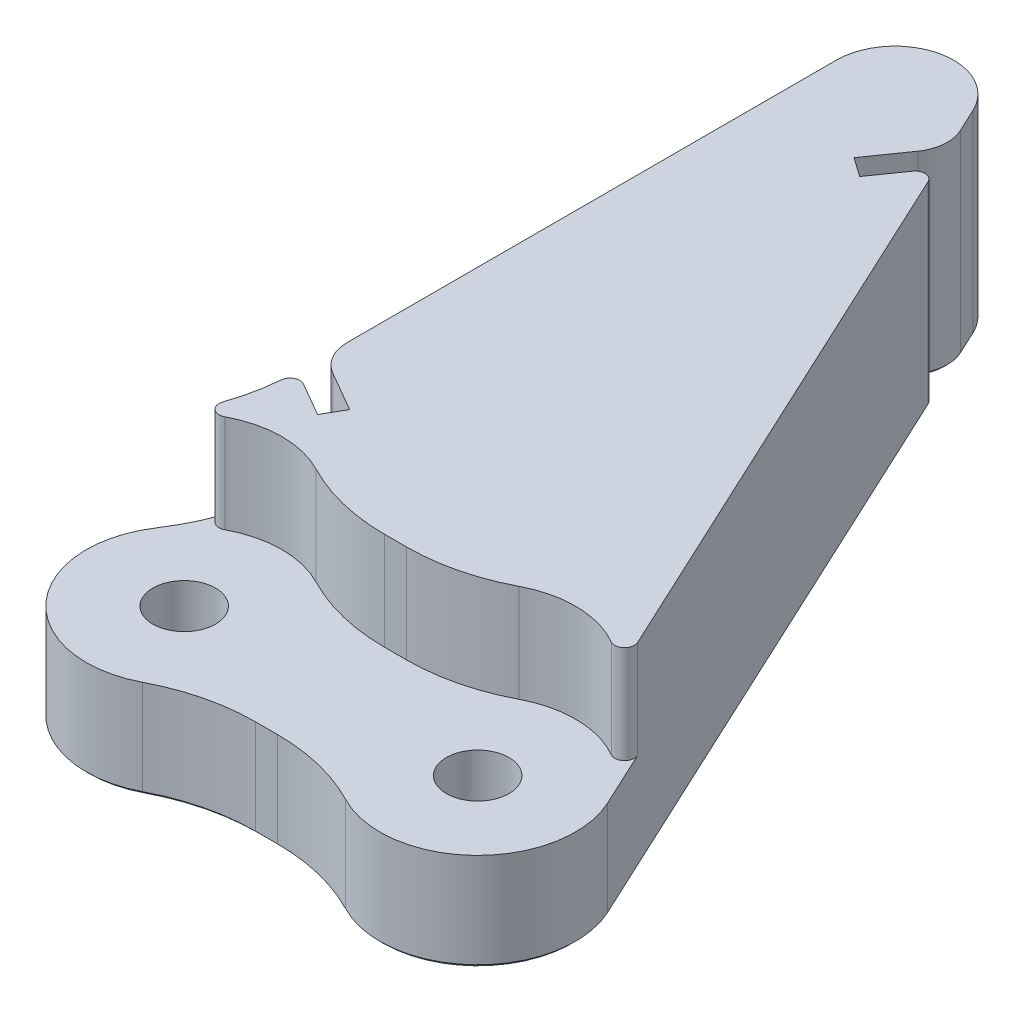
from build123d import *

# Parameters (mm, degrees)
MAIN_BODY_DEPTH                           = 10
SKETCH1_3_R                               = 1.6
CONNECTOR_BODY_DEPTH                      = 5
DULLING_FILLET_START                      = 5
DULLING_FILLET_DEPTH                      = 6
CUT_EXTRUDE1_DEPTH                        = 45.806187552
FILLET1_R                                 = 2
FILLET2_R                                 = 0.5
ELEPHANTSFOOT_COMPENSATION_LEFT_CONF_SIZE = 0.16


with BuildPart() as part:
    # complete_sketch → main_body (new body)
    with BuildSketch(Plane(origin=(0, 0, 0), x_dir=(1, 0, 0), z_dir=(0, 1, 0))):
        with BuildLine():
            ThreePointArc((-2.5, 8.291561976), (-2.925728922, 5.40481063), (-4.166666667, 2.763853992))
            ThreePointArc((-4.166666667, 2.763853992), (-1.24767584, 4.841828683), (2.312045751, 4.433333333))
            ThreePointArc((2.312045751, 4.433333333), (4.555661111, 3.587465144), (6.936137254, 3.3))
            Line((6.936137254, 3.3), (8.063862746, 3.3))
            ThreePointArc((8.063862746, 3.3), (10.444338889, 3.587465144), (12.687954249, 4.433333333))
            ThreePointArc((12.687954249, 4.433333333), (16.605433979, 4.735248857), (19.531538935, 2.113091309))
            Line((19.531538935, 2.113091309), (3.218923361, 37.095608299))
            ThreePointArc((3.218923361, 37.095608299), (-0.149318842, 38.756641535), (-2.5, 35.827753514))
            Line((-2.5, 35.827753514), (-2.5, 8.291561976))
        make_face()
    extrude(amount=MAIN_BODY_DEPTH)

    # Sketch1<3> → connector_body (add)
    with BuildSketch(Plane(origin=(0, 0, 0), x_dir=(1, 0, 0), z_dir=(0, 1, 0))):
        with BuildLine():
            ThreePointArc((2.312045751, -4.433333333), (4.555661111, -3.587465144), (6.936137254, -3.3))
            Line((6.936137254, -3.3), (8.063862746, -3.3))
            ThreePointArc((8.063862746, -3.3), (10.444338889, -3.587465144), (12.687954249, -4.433333333))
            ThreePointArc((12.687954249, -4.433333333), (18.456219958, -3.613107195), (19.531538935, 2.113091309))
            ThreePointArc((19.531538935, 2.113091309), (16.605433979, 4.735248857), (12.687954249, 4.433333333))
            ThreePointArc((12.687954249, 4.433333333), (10.444338889, 3.587465144), (8.063862746, 3.3))
            Line((8.063862746, 3.3), (6.936137254, 3.3))
            ThreePointArc((6.936137254, 3.3), (4.555661111, 3.587465144), (2.312045751, 4.433333333))
            ThreePointArc((2.312045751, 4.433333333), (-1.24767584, 4.841828683), (-4.166666667, 2.763853992))
            ThreePointArc((-4.166666667, 2.763853992), (-3.716151374, -3.345178466), (2.312045751, -4.433333333))
        make_face()
        with Locations(Location((0, 0, 0), (0, 0, 270))):
            Circle(SKETCH1_3_R, mode=Mode.SUBTRACT)
        with Locations(Location((15, 0, 0), (0, 0, 270))):
            Circle(SKETCH1_3_R, mode=Mode.SUBTRACT)
    extrude(amount=CONNECTOR_BODY_DEPTH)

    # dulling_fillet: read off the stored shape, not the designer's step
    # dulling_fillet outline → dulling_fillet (cut)
    with BuildSketch(Plane(origin=(0, 0, 0), x_dir=(1, 0, 0), z_dir=(0, 1, 0)).offset(DULLING_FILLET_START)):
        with BuildLine():
            Line((19.531538935, 2.113091309), (18.195102647, 4.979088177))
            ThreePointArc((18.195102647, 4.979088177), (18.080055144, 4.399425861), (17.492680685, 4.334344587))
            ThreePointArc((17.492680685, 4.334344587), (18.683531845, 3.381063908), (19.531538935, 2.113091309))
        make_face()
        with BuildLine():
            ThreePointArc((-4.166666667, 2.763853992), (-3.358016887, 3.704554303), (-2.342670216, 4.417227214))
            ThreePointArc((-2.342670216, 4.417227214), (-2.902133749, 4.479151002), (-3.049464036, 5.022407651))
            ThreePointArc((-3.049464036, 5.022407651), (-3.536643042, 3.85780149), (-4.166666667, 2.763853992))
        make_face()
    extrude(amount=DULLING_FILLET_DEPTH, mode=Mode.SUBTRACT)

    # Sketch2 → Cut-Extrude1 (cut, through all)
    with BuildSketch(Plane(origin=(0, 10, 0), x_dir=(1, 0, 0), z_dir=(0, 1, 0))):
        Polygon((-2.5, 8.291561976), (-0.068911087, 6.887972137), (0.531088913, 7.927202622), (-2.5, 9.677202622), align=None)
        Polygon((4.275469015, 34.829838831), (2.267951488, 31.962806676), (3.250933941, 31.274514953), (4.861066057, 33.574021924), align=None)
    extrude(amount=-CUT_EXTRUDE1_DEPTH, mode=Mode.SUBTRACT)

    # Fillet1
    fillet1_edges = [part.edges().sort_by_distance(p)[0] for p in [
        (-2.5, 5, -9.677202622),
        (4.275469015, 5, -34.829838831),
    ]]
    fillet(fillet1_edges, radius=FILLET1_R)

    # Fillet2
    fillet2_edges = [part.edges().sort_by_distance(p)[0] for p in [
        (4.861066057, 5, -33.574021924),
        (-2.5, 5, -8.291561976),
    ]]
    fillet(fillet2_edges, radius=FILLET2_R)

    # elephantsfoot_compensation_left_conf
    elephantsfoot_compensation_left_conf_edges = [part.edges().sort_by_distance(p)[0] for p in [
        (0.231088913, 0, -7.40758738),
        (3.807634117, 0, -32.069565198),
        (2.759442715, 0, -31.618660815),
        (-2.5, 0, -23.329828337),
        (2.940555742, 0, -32.923385101),
        (-0.149318842, 0, -38.756641535),
        (3.503197421, 0, -36.48598061),
        (-2.232050808, 0, -9.83190316),
        (3.967245303, 0, -34.856804912),
        (12.379301571, 0, -17.451113833),
        (-3.049950658, 0, -5.021001256),
        (-0.926536362, 0, -7.383122321),
        (-2.266493544, 0, -7.888003391),
        (4.817488185, 0, -33.075924575),
        (-3.716151374, 0, 3.345178466),
        (18.456219958, 0, 3.613107195),
        (7.5, 0, 3.3),
        (10.444338889, 0, 3.587465144),
        (0, 0, -1.6),
        (15, 0, -1.6),
        (4.555661111, 0, 3.587465144),
        (-0.484455543, 0, -8.513527487),
    ]]
    chamfer(elephantsfoot_compensation_left_conf_edges, length=ELEPHANTSFOOT_COMPENSATION_LEFT_CONF_SIZE)


solid = part.part
